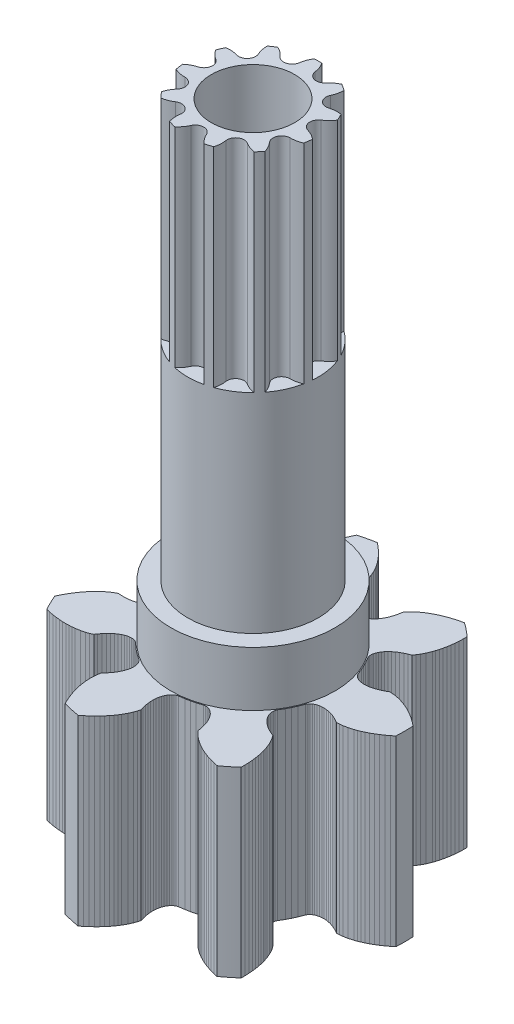
from build123d import *

# Parameters (mm, degrees)
SKETCH1_R           = 3.15
BOSS_EXTRUDE1_DEPTH = 2.1
SKETCH2_R           = 2.5
BOSS_EXTRUDE3_DEPTH = 16
BOSS_EXTRUDE4_DEPTH = 7
SKETCH3_R           = 1.1
SKETCH3_R_2         = 0.75
CUT_EXTRUDE2_DEPTH  = 20.858328167
SKETCH6_R           = 1.7
CUT_EXTRUDE3_DEPTH  = 7.6
SKETCH7_R           = 1.6
CUT_EXTRUDE4_DEPTH  = 20.313031807
SKETCH8_OUTSIDE_W   = 19.149
SKETCH8_OUTSIDE_H   = 19.428
CUT_EXTRUDE5_DEPTH  = 8


with BuildPart() as part:
    # Sketch1 → Boss-Extrude1 (new body)
    with BuildSketch(Plane(origin=(0, 0, 0), x_dir=(1, 0, 0), z_dir=(0, 1, 0))):
        with Locations(Location((0, 0, 0), (0, 0, 270))):
            Circle(SKETCH1_R)
    extrude(amount=BOSS_EXTRUDE1_DEPTH)

    # Sketch2 → Boss-Extrude3 (add)
    with BuildSketch(Plane(origin=(0, 2.1, 0), x_dir=(1, 0, 0), z_dir=(0, 1, 0))):
        with Locations(Location((0, 0, 0), (0, 0, 270))):
            Circle(SKETCH2_R)
    extrude(amount=BOSS_EXTRUDE3_DEPTH)

    # Sketch4 → Boss-Extrude4 (add)
    with BuildSketch(Plane.XZ):
        with BuildLine():
            Line((-1.677656104, -5.457545802), (-1.740166904, -5.314388502))
            Line((-1.740166904, -5.314388502), (-1.793915704, -5.175673402))
            Line((-1.793915704, -5.175673402), (-1.839244704, -5.042342702))
            Line((-1.839244704, -5.042342702), (-1.876421604, -4.915999102))
            Line((-1.876421604, -4.915999102), (-1.907053904, -4.793237402))
            Line((-1.907053904, -4.793237402), (-1.931099704, -4.676009702))
            Line((-1.931099704, -4.676009702), (-1.948773704, -4.566830802))
            Line((-1.948773704, -4.566830802), (-1.961024804, -4.464035702))
            Line((-1.961024804, -4.464035702), (-1.971502404, -4.279785302))
            Line((-1.971502404, -4.279785302), (-1.967365804, -4.124635702))
            Line((-1.967365804, -4.124635702), (-1.953730504, -4.000928102))
            Line((-1.953730504, -4.000928102), (-1.930260404, -3.886700602))
            Line((-1.930260404, -3.886700602), (-1.859391804, -3.809735002))
            Line((-1.859391804, -3.809735002), (-1.778417204, -3.712510502))
            Line((-1.778417204, -3.712510502), (-1.708697804, -3.615493902))
            Line((-1.708697804, -3.615493902), (-1.650076104, -3.519450202))
            Line((-1.650076104, -3.519450202), (-1.602332404, -3.425130202))
            Line((-1.602332404, -3.425130202), (-1.565200104, -3.333258302))
            Line((-1.565200104, -3.333258302), (-1.538382904, -3.244569502))
            Line((-1.538382904, -3.244569502), (-1.521548504, -3.159737902))
            Line((-1.521548504, -3.159737902), (-1.514299404, -3.079451802))
            Line((-1.514299404, -3.079451802), (-1.516222204, -3.004347502))
            Line((-1.516222204, -3.004347502), (-1.526863004, -2.935043002))
            Line((-1.526863004, -2.935043002), (-1.545721204, -2.872129302))
            Line((-1.545721204, -2.872129302), (-1.572279104, -2.816160102))
            Line((-1.572279104, -2.816160102), (-1.605971904, -2.767662302))
            Line((-1.605971904, -2.767662302), (-1.657232504, -2.718290402))
            Line((-1.657232504, -2.718290402), (-1.844744204, -2.592775302))
            Line((-1.844744204, -2.592775302), (-1.984007204, -2.487817902))
            Line((-1.984007204, -2.487817902), (-2.117322004, -2.375401802))
            Line((-2.117322004, -2.375401802), (-2.281415504, -2.220521102))
            Line((-2.281415504, -2.220521102), (-2.340956004, -2.181532002))
            Line((-2.340956004, -2.181532002), (-2.395735304, -2.159475702))
            Line((-2.395735304, -2.159475702), (-2.456210904, -2.146038102))
            Line((-2.456210904, -2.146038102), (-2.521743604, -2.141652302))
            Line((-2.521743604, -2.141652302), (-2.591678304, -2.146699902))
            Line((-2.591678304, -2.146699902), (-2.665327304, -2.161537602))
            Line((-2.665327304, -2.161537602), (-2.741987504, -2.186470302))
            Line((-2.741987504, -2.186470302), (-2.820946104, -2.221759402))
            Line((-2.820946104, -2.221759402), (-2.901443904, -2.267639402))
            Line((-2.901443904, -2.267639402), (-2.982749704, -2.324284202))
            Line((-2.982749704, -2.324284202), (-3.064080904, -2.391819002))
            Line((-3.064080904, -2.391819002), (-3.144672004, -2.470342602))
            Line((-3.144672004, -2.470342602), (-3.223742204, -2.559902302))
            Line((-3.223742204, -2.559902302), (-3.300510504, -2.660481102))
            Line((-3.300510504, -2.660481102), (-3.359776704, -2.746699402))
            Line((-3.359776704, -2.746699402), (-3.465917704, -2.794999002))
            Line((-3.465917704, -2.794999002), (-3.583489604, -2.835820002))
            Line((-3.583489604, -2.835820002), (-3.733828804, -2.874377002))
            Line((-3.733828804, -2.874377002), (-3.915791104, -2.905161502))
            Line((-3.915791104, -2.905161502), (-4.018735004, -2.916091602))
            Line((-4.018735004, -2.916091602), (-4.129109504, -2.923155402))
            Line((-4.129109504, -2.923155402), (-4.248748704, -2.925798102))
            Line((-4.248748704, -2.925798102), (-4.375248804, -2.923250802))
            Line((-4.375248804, -2.923250802), (-4.506697404, -2.915120202))
            Line((-4.506697404, -2.915120202), (-4.646771904, -2.900596502))
            Line((-4.646771904, -2.900596502), (-4.793969404, -2.879062302))
            Line((-4.793969404, -2.879062302), (-4.947447304, -2.849974302))
            Line((-4.947447304, -2.849974302), (-5.090225304, -2.816749202))
            ThreePointArc((-5.090225304, -2.816749202), (-5.241476502, -2.524161997), (-5.375926806, -2.223483907))
            Line((-5.375926806, -2.223483907), (-5.312882596, -2.091140098))
            Line((-5.312882596, -2.091140098), (-5.239932596, -1.953010098))
            Line((-5.239932596, -1.953010098), (-5.164992596, -1.824500098))
            Line((-5.164992596, -1.824500098), (-5.089012596, -1.705930098))
            Line((-5.089012596, -1.705930098), (-5.013412596, -1.598090098))
            Line((-5.013412596, -1.598090098), (-4.936532596, -1.497600098))
            Line((-4.936532596, -1.497600098), (-4.859872596, -1.405710098))
            Line((-4.859872596, -1.405710098), (-4.785532596, -1.323820098))
            Line((-4.785532596, -1.323820098), (-4.712802596, -1.250150098))
            Line((-4.712802596, -1.250150098), (-4.575282596, -1.127080098))
            Line((-4.575282596, -1.127080098), (-4.451402596, -1.033580098))
            Line((-4.451402596, -1.033580098), (-4.346182596, -0.967110098))
            Line((-4.346182596, -0.967110098), (-4.242242596, -0.914240098))
            Line((-4.242242596, -0.914240098), (-4.137882596, -0.921660098))
            Line((-4.137882596, -0.921660098), (-4.011382596, -0.924350098))
            Line((-4.011382596, -0.924350098), (-3.892062596, -0.918370098))
            Line((-3.892062596, -0.918370098), (-3.780422596, -0.904320098))
            Line((-3.780422596, -0.904320098), (-3.676912596, -0.882840098))
            Line((-3.676912596, -0.882840098), (-3.581932596, -0.854590098))
            Line((-3.581932596, -0.854590098), (-3.495872596, -0.820260098))
            Line((-3.495872596, -0.820260098), (-3.419052596, -0.780530098))
            Line((-3.419052596, -0.780530098), (-3.351762596, -0.736140098))
            Line((-3.351762596, -0.736140098), (-3.294242596, -0.687810098))
            Line((-3.294242596, -0.687810098), (-3.246692596, -0.636280098))
            Line((-3.246692596, -0.636280098), (-3.209262596, -0.582310098))
            Line((-3.209262596, -0.582310098), (-3.182062596, -0.526650098))
            Line((-3.182062596, -0.526650098), (-3.165152596, -0.470070098))
            Line((-3.165152596, -0.470070098), (-3.158512596, -0.399210098))
            Line((-3.158512596, -0.399210098), (-3.177292596, -0.174350098))
            Line((-3.177292596, -0.174350098), (-3.182062596, -3.0098e-05))
            Line((-3.182062596, -3.0098e-05), (-3.177292596, 0.174289902))
            Line((-3.177292596, 0.174289902), (-3.158512596, 0.399149902))
            Line((-3.158512596, 0.399149902), (-3.165152596, 0.470009902))
            Line((-3.165152596, 0.470009902), (-3.182062596, 0.526589902))
            Line((-3.182062596, 0.526589902), (-3.209262596, 0.582249902))
            Line((-3.209262596, 0.582249902), (-3.246692596, 0.636219902))
            Line((-3.246692596, 0.636219902), (-3.294242596, 0.687749902))
            Line((-3.294242596, 0.687749902), (-3.351762596, 0.736079902))
            Line((-3.351762596, 0.736079902), (-3.419052596, 0.780469902))
            Line((-3.419052596, 0.780469902), (-3.495872596, 0.820199902))
            Line((-3.495872596, 0.820199902), (-3.581932596, 0.854529902))
            Line((-3.581932596, 0.854529902), (-3.676912596, 0.882779902))
            Line((-3.676912596, 0.882779902), (-3.780422596, 0.904259902))
            Line((-3.780422596, 0.904259902), (-3.892062596, 0.918309902))
            Line((-3.892062596, 0.918309902), (-4.011382596, 0.924289902))
            Line((-4.011382596, 0.924289902), (-4.137882596, 0.921599902))
            Line((-4.137882596, 0.921599902), (-4.242242596, 0.914179902))
            Line((-4.242242596, 0.914179902), (-4.346182596, 0.967049902))
            Line((-4.346182596, 0.967049902), (-4.451402596, 1.033519902))
            Line((-4.451402596, 1.033519902), (-4.575282596, 1.127019902))
            Line((-4.575282596, 1.127019902), (-4.712802596, 1.250089902))
            Line((-4.712802596, 1.250089902), (-4.785532596, 1.323759902))
            Line((-4.785532596, 1.323759902), (-4.859872596, 1.405649902))
            Line((-4.859872596, 1.405649902), (-4.936532596, 1.497539902))
            Line((-4.936532596, 1.497539902), (-5.013412596, 1.598029902))
            Line((-5.013412596, 1.598029902), (-5.089012596, 1.705869902))
            Line((-5.089012596, 1.705869902), (-5.164992596, 1.824439902))
            Line((-5.164992596, 1.824439902), (-5.239932596, 1.952949902))
            Line((-5.239932596, 1.952949902), (-5.312882596, 2.091079902))
            Line((-5.312882596, 2.091079902), (-5.375926796, 2.223423702))
            ThreePointArc((-5.375926796, 2.223423702), (-5.241476491, 2.524101771), (-5.090225294, 2.816688957))
            Line((-5.090225294, 2.816688957), (-4.947447286, 2.849914054))
            Line((-4.947447286, 2.849914054), (-4.793969386, 2.879002054))
            Line((-4.793969386, 2.879002054), (-4.646771886, 2.900536254))
            Line((-4.646771886, 2.900536254), (-4.506697386, 2.915059954))
            Line((-4.506697386, 2.915059954), (-4.375248786, 2.923190554))
            Line((-4.375248786, 2.923190554), (-4.248748686, 2.925737854))
            Line((-4.248748686, 2.925737854), (-4.129109486, 2.923095154))
            Line((-4.129109486, 2.923095154), (-4.018734986, 2.916031354))
            Line((-4.018734986, 2.916031354), (-3.915791086, 2.905101254))
            Line((-3.915791086, 2.905101254), (-3.733828786, 2.874316754))
            Line((-3.733828786, 2.874316754), (-3.583489586, 2.835759754))
            Line((-3.583489586, 2.835759754), (-3.465917686, 2.794938754))
            Line((-3.465917686, 2.794938754), (-3.359776686, 2.746639154))
            Line((-3.359776686, 2.746639154), (-3.300510486, 2.660420854))
            Line((-3.300510486, 2.660420854), (-3.223742186, 2.559842054))
            Line((-3.223742186, 2.559842054), (-3.144671986, 2.470282354))
            Line((-3.144671986, 2.470282354), (-3.064080886, 2.391758754))
            Line((-3.064080886, 2.391758754), (-2.982749686, 2.324223954))
            Line((-2.982749686, 2.324223954), (-2.901443886, 2.267579154))
            Line((-2.901443886, 2.267579154), (-2.820946086, 2.221699154))
            Line((-2.820946086, 2.221699154), (-2.741987486, 2.186410054))
            Line((-2.741987486, 2.186410054), (-2.665327286, 2.161477354))
            Line((-2.665327286, 2.161477354), (-2.591678286, 2.146639654))
            Line((-2.591678286, 2.146639654), (-2.521743586, 2.141592054))
            Line((-2.521743586, 2.141592054), (-2.456210886, 2.145977854))
            Line((-2.456210886, 2.145977854), (-2.395735286, 2.159415454))
            Line((-2.395735286, 2.159415454), (-2.340955986, 2.181471754))
            Line((-2.340955986, 2.181471754), (-2.281415486, 2.220460854))
            Line((-2.281415486, 2.220460854), (-2.117321986, 2.375341554))
            Line((-2.117321986, 2.375341554), (-1.984007186, 2.487757654))
            Line((-1.984007186, 2.487757654), (-1.844744186, 2.592715054))
            Line((-1.844744186, 2.592715054), (-1.657232486, 2.718230154))
            Line((-1.657232486, 2.718230154), (-1.605971886, 2.767602054))
            Line((-1.605971886, 2.767602054), (-1.572279086, 2.816099854))
            Line((-1.572279086, 2.816099854), (-1.545721186, 2.872069054))
            Line((-1.545721186, 2.872069054), (-1.526862986, 2.934982754))
            Line((-1.526862986, 2.934982754), (-1.516222186, 3.004287254))
            Line((-1.516222186, 3.004287254), (-1.514299386, 3.079391554))
            Line((-1.514299386, 3.079391554), (-1.521548486, 3.159677654))
            Line((-1.521548486, 3.159677654), (-1.538382886, 3.244509254))
            Line((-1.538382886, 3.244509254), (-1.565200086, 3.333198054))
            Line((-1.565200086, 3.333198054), (-1.602332386, 3.425069954))
            Line((-1.602332386, 3.425069954), (-1.650076086, 3.519389954))
            Line((-1.650076086, 3.519389954), (-1.708697786, 3.615433654))
            Line((-1.708697786, 3.615433654), (-1.778417186, 3.712450254))
            Line((-1.778417186, 3.712450254), (-1.859391786, 3.809674754))
            Line((-1.859391786, 3.809674754), (-1.930260386, 3.886640354))
            Line((-1.930260386, 3.886640354), (-1.953730486, 4.000867854))
            Line((-1.953730486, 4.000867854), (-1.967365786, 4.124575454))
            Line((-1.967365786, 4.124575454), (-1.971502386, 4.279725054))
            Line((-1.971502386, 4.279725054), (-1.961024786, 4.463975454))
            Line((-1.961024786, 4.463975454), (-1.948773686, 4.566770554))
            Line((-1.948773686, 4.566770554), (-1.931099686, 4.675949454))
            Line((-1.931099686, 4.675949454), (-1.907053886, 4.793177154))
            Line((-1.907053886, 4.793177154), (-1.876421586, 4.915938854))
            Line((-1.876421586, 4.915938854), (-1.839244686, 5.042282454))
            Line((-1.839244686, 5.042282454), (-1.793915686, 5.175613154))
            Line((-1.793915686, 5.175613154), (-1.740166886, 5.314328254))
            Line((-1.740166886, 5.314328254), (-1.677656086, 5.457485554))
            Line((-1.677656086, 5.457485554), (-1.613492886, 5.589290554))
            ThreePointArc((-1.613492886, 5.589290554), (-1.294584924, 5.671642777), (-0.971527485, 5.735814951))
            Line((-0.971527485, 5.735814951), (-0.856530379, 5.644902123))
            Line((-0.856530379, 5.644902123), (-0.738096579, 5.543044323))
            Line((-0.738096579, 5.543044323), (-0.629484279, 5.441387023))
            Line((-0.629484279, 5.441387023), (-0.530794179, 5.340927723))
            Line((-0.530794179, 5.340927723), (-0.442480579, 5.243226523))
            Line((-0.442480579, 5.243226523), (-0.361617479, 5.145912923))
            Line((-0.361617479, 5.145912923), (-0.289089779, 5.050727423))
            Line((-0.289089779, 5.050727423), (-0.225795179, 4.960029123))
            Line((-0.225795179, 4.960029123), (-0.170156179, 4.872729423))
            Line((-0.170156179, 4.872729423), (-0.080772879, 4.711271723))
            Line((-0.080772879, 4.711271723), (-0.017182979, 4.569691923))
            Line((-0.017182979, 4.569691923), (0.024206821, 4.452319023))
            Line((0.024206821, 4.452319023), (0.052622421, 4.339220423))
            Line((0.052622421, 4.339220423), (0.022166221, 4.239128023))
            Line((0.022166221, 4.239128023), (-0.008605279, 4.116398223))
            Line((-0.008605279, 4.116398223), (-0.029326379, 3.998739123))
            Line((-0.029326379, 3.998739123), (-0.040470879, 3.886771723))
            Line((-0.040470879, 3.886771723), (-0.042562579, 3.781077223))
            Line((-0.042562579, 3.781077223), (-0.036155879, 3.682192323))
            Line((-0.036155879, 3.682192323), (-0.021836779, 3.590650923))
            Line((-0.021836779, 3.590650923), (-0.000196979, 3.506916223))
            Line((-0.000196979, 3.506916223), (0.028106621, 3.431435623))
            Line((0.028106621, 3.431435623), (0.062425521, 3.364603323))
            Line((0.062425521, 3.364603323), (0.102082621, 3.306779023))
            Line((0.102082621, 3.306779023), (0.146370621, 3.258277923))
            Line((0.146370621, 3.258277923), (0.194582521, 3.219374423))
            Line((0.194582521, 3.219374423), (0.245981121, 3.190298123))
            Line((0.245981121, 3.190298123), (0.313586921, 3.168056823))
            Line((0.313586921, 3.168056823), (0.536988121, 3.136329923))
            Line((0.536988121, 3.136329923), (0.707999021, 3.102190423))
            Line((0.707999021, 3.102190423), (0.876887021, 3.058750223))
            Line((0.876887021, 3.058750223), (1.091930421, 2.990405023))
            Line((1.091930421, 2.990405023), (1.162491321, 2.981110623))
            Line((1.162491321, 2.981110623), (1.221415521, 2.985006423))
            Line((1.221415521, 2.985006423), (1.281732621, 2.999139023))
            Line((1.281732621, 2.999139023), (1.342678421, 3.023621123))
            Line((1.342678421, 3.023621123), (1.403497321, 3.058512423))
            Line((1.403497321, 3.058512423), (1.463415021, 3.103835823))
            Line((1.463415021, 3.103835823), (1.521665521, 3.159561023))
            Line((1.521665521, 3.159561023), (1.577493421, 3.225614223))
            Line((1.577493421, 3.225614223), (1.630112821, 3.301877423))
            Line((1.630112821, 3.301877423), (1.678789621, 3.388189823))
            Line((1.678789621, 3.388189823), (1.722764221, 3.484324823))
            Line((1.722764221, 3.484324823), (1.761304221, 3.590039423))
            Line((1.761304221, 3.590039423), (1.793685421, 3.705037123))
            Line((1.793685421, 3.705037123), (1.819211821, 3.828964023))
            Line((1.819211821, 3.828964023), (1.835200121, 3.932358623))
            Line((1.835200121, 3.932358623), (1.909873421, 4.021928023))
            Line((1.909873421, 4.021928023), (1.998090521, 4.109718923))
            Line((1.998090521, 4.109718923), (2.116812121, 4.209687323))
            Line((2.116812121, 4.209687323), (2.267397621, 4.316373723))
            Line((2.267397621, 4.316373723), (2.355404521, 4.370887123))
            Line((2.355404521, 4.370887123), (2.451783521, 4.425141023))
            Line((2.451783521, 4.425141023), (2.558428121, 4.479431523))
            Line((2.558428121, 4.479431523), (2.673506021, 4.532022823))
            Line((2.673506021, 4.532022823), (2.795464821, 4.581730723))
            Line((2.795464821, 4.581730723), (2.927969221, 4.629421523))
            Line((2.927969221, 4.629421523), (3.069932921, 4.673886423))
            Line((3.069932921, 4.673886423), (3.220832621, 4.714270623))
            Line((3.220832621, 4.714270623), (3.363886921, 4.746284823))
            ThreePointArc((3.363886921, 4.746284823), (3.627108363, 4.548298309), (3.878703226, 4.335732528))
            Line((3.878703226, 4.335732528), (3.879324236, 4.189141042))
            Line((3.879324236, 4.189141042), (3.873530936, 4.033038442))
            Line((3.873530936, 4.033038442), (3.861770736, 3.884739642))
            Line((3.861770736, 3.884739642), (3.844760636, 3.744945242))
            Line((3.844760636, 3.744945242), (3.823437436, 3.614983242))
            Line((3.823437436, 3.614983242), (3.797771936, 3.491087842))
            Line((3.797771936, 3.491087842), (3.768573236, 3.375036342))
            Line((3.768573236, 3.375036342), (3.737125936, 3.269001042))
            Line((3.737125936, 3.269001042), (3.703562736, 3.171070342))
            Line((3.703562736, 3.171070342), (3.633059536, 3.000520342))
            Line((3.633059536, 3.000520342), (3.562015636, 2.862530242))
            Line((3.562015636, 2.862530242), (3.496055936, 2.756989642))
            Line((3.496055936, 2.756989642), (3.425348736, 2.664257542))
            Line((3.425348736, 2.664257542), (3.328104136, 2.625662642))
            Line((3.328104136, 2.625662642), (3.212964436, 2.573199942))
            Line((3.212964436, 2.573199942), (3.108055436, 2.516041142))
            Line((3.108055436, 2.516041142), (3.013567336, 2.454943742))
            Line((3.013567336, 2.454943742), (2.929627936, 2.390679642))
            Line((2.929627936, 2.390679642), (2.856311136, 2.324016942))
            Line((2.856311136, 2.324016942), (2.793668936, 2.255746642))
            Line((2.793668936, 2.255746642), (2.741694736, 2.186620242))
            Line((2.741694736, 2.186620242), (2.700328636, 2.117430142))
            Line((2.700328636, 2.117430142), (2.669474536, 2.048929342))
            Line((2.669474536, 2.048929342), (2.648991436, 1.981871242))
            Line((2.648991436, 1.981871242), (2.638684936, 1.917005642))
            Line((2.638684936, 1.917005642), (2.638328536, 1.855056142))
            Line((2.638328536, 1.855056142), (2.647642236, 1.796742342))
            Line((2.647642236, 1.796742342), (2.672404836, 1.730018642))
            Line((2.672404836, 1.730018642), (2.786888136, 1.535575142))
            Line((2.786888136, 1.535575142), (2.866820336, 1.380587942))
            Line((2.866820336, 1.380587942), (2.938157336, 1.221461342))
            Line((2.938157336, 1.221461342), (3.018800236, 1.010721142))
            Line((3.018800236, 1.010721142), (3.055527736, 0.949759542))
            Line((3.055527736, 0.949759542), (3.095312236, 0.906119642))
            Line((3.095312236, 0.906119642), (3.143968536, 0.867773342))
            Line((3.143968536, 0.867773342), (3.201108536, 0.835388342))
            Line((3.201108536, 0.835388342), (3.266307636, 0.809592642))
            Line((3.266307636, 0.809592642), (3.339100936, 0.791005742))
            Line((3.339100936, 0.791005742), (3.418987236, 0.780207842))
            Line((3.418987236, 0.780207842), (3.505437836, 0.777743242))
            Line((3.505437836, 0.777743242), (3.597870436, 0.784153042))
            Line((3.597870436, 0.784153042), (3.695701736, 0.799910942))
            Line((3.695701736, 0.799910942), (3.798280836, 0.825469442))
            Line((3.798280836, 0.825469442), (3.904961036, 0.861249642))
            Line((3.904961036, 0.861249642), (4.015059336, 0.907632842))
            Line((4.015059336, 0.907632842), (4.127864736, 0.964942742))
            Line((4.127864736, 0.964942742), (4.218670436, 1.016908042))
            Line((4.218670436, 1.016908042), (4.335256536, 1.014371642))
            Line((4.335256536, 1.014371642), (4.458896736, 1.000137542))
            Line((4.458896736, 1.000137542), (4.611076836, 0.969646442))
            Line((4.611076836, 0.969646442), (4.788376236, 0.918431942))
            Line((4.788376236, 0.918431942), (4.885867836, 0.883613842))
            Line((4.885867836, 0.883613842), (4.988376636, 0.842088442))
            Line((4.988376636, 0.842088442), (5.097314536, 0.792559942))
            Line((5.097314536, 0.792559942), (5.210181936, 0.735378542))
            Line((5.210181936, 0.735378542), (5.325085236, 0.671019742))
            Line((5.325085236, 0.671019742), (5.444986436, 0.597158342))
            Line((5.444986436, 0.597158342), (5.568263436, 0.513890042))
            Line((5.568263436, 0.513890042), (5.693921436, 0.421091042))
            Line((5.693921436, 0.421091042), (5.808144136, 0.329207242))
            ThreePointArc((5.808144136, 0.329207242), (5.817467929, -3.016e-05), (5.808144136, -0.329267562))
            Line((5.808144136, -0.329267562), (5.693921429, -0.421151358))
            Line((5.693921429, -0.421151358), (5.568263429, -0.513950358))
            Line((5.568263429, -0.513950358), (5.444986429, -0.597218658))
            Line((5.444986429, -0.597218658), (5.325085229, -0.671080058))
            Line((5.325085229, -0.671080058), (5.210181929, -0.735438858))
            Line((5.210181929, -0.735438858), (5.097314529, -0.792620258))
            Line((5.097314529, -0.792620258), (4.988376629, -0.842148758))
            Line((4.988376629, -0.842148758), (4.885867829, -0.883674158))
            Line((4.885867829, -0.883674158), (4.788376229, -0.918492258))
            Line((4.788376229, -0.918492258), (4.611076829, -0.969706758))
            Line((4.611076829, -0.969706758), (4.458896729, -1.000197858))
            Line((4.458896729, -1.000197858), (4.335256529, -1.014431958))
            Line((4.335256529, -1.014431958), (4.218670429, -1.016968358))
            Line((4.218670429, -1.016968358), (4.127864729, -0.965003058))
            Line((4.127864729, -0.965003058), (4.015059329, -0.907693158))
            Line((4.015059329, -0.907693158), (3.904961029, -0.861309958))
            Line((3.904961029, -0.861309958), (3.798280829, -0.825529758))
            Line((3.798280829, -0.825529758), (3.695701729, -0.799971258))
            Line((3.695701729, -0.799971258), (3.597870429, -0.784213358))
            Line((3.597870429, -0.784213358), (3.505437829, -0.777803558))
            Line((3.505437829, -0.777803558), (3.418987229, -0.780268158))
            Line((3.418987229, -0.780268158), (3.339100929, -0.791066058))
            Line((3.339100929, -0.791066058), (3.266307629, -0.809652958))
            Line((3.266307629, -0.809652958), (3.201108529, -0.835448658))
            Line((3.201108529, -0.835448658), (3.143968529, -0.867833658))
            Line((3.143968529, -0.867833658), (3.095312229, -0.906179958))
            Line((3.095312229, -0.906179958), (3.055527729, -0.949819858))
            Line((3.055527729, -0.949819858), (3.018800229, -1.010781458))
            Line((3.018800229, -1.010781458), (2.938157329, -1.221521658))
            Line((2.938157329, -1.221521658), (2.866820329, -1.380648258))
            Line((2.866820329, -1.380648258), (2.786888129, -1.535635458))
            Line((2.786888129, -1.535635458), (2.672404829, -1.730078958))
            Line((2.672404829, -1.730078958), (2.647642229, -1.796802658))
            Line((2.647642229, -1.796802658), (2.638328529, -1.855116458))
            Line((2.638328529, -1.855116458), (2.638684929, -1.917065958))
            Line((2.638684929, -1.917065958), (2.648991429, -1.981931558))
            Line((2.648991429, -1.981931558), (2.669474529, -2.048989658))
            Line((2.669474529, -2.048989658), (2.700328629, -2.117490458))
            Line((2.700328629, -2.117490458), (2.741694729, -2.186680558))
            Line((2.741694729, -2.186680558), (2.793668929, -2.255806958))
            Line((2.793668929, -2.255806958), (2.856311129, -2.324077258))
            Line((2.856311129, -2.324077258), (2.929627929, -2.390739958))
            Line((2.929627929, -2.390739958), (3.013567329, -2.455004058))
            Line((3.013567329, -2.455004058), (3.108055429, -2.516101458))
            Line((3.108055429, -2.516101458), (3.212964429, -2.573260258))
            Line((3.212964429, -2.573260258), (3.328104129, -2.625722958))
            Line((3.328104129, -2.625722958), (3.425348729, -2.664317858))
            Line((3.425348729, -2.664317858), (3.496055929, -2.757049958))
            Line((3.496055929, -2.757049958), (3.562015629, -2.862590558))
            Line((3.562015629, -2.862590558), (3.633059529, -3.000580658))
            Line((3.633059529, -3.000580658), (3.703562729, -3.171130658))
            Line((3.703562729, -3.171130658), (3.737125929, -3.269061358))
            Line((3.737125929, -3.269061358), (3.768573229, -3.375096658))
            Line((3.768573229, -3.375096658), (3.797771929, -3.491148158))
            Line((3.797771929, -3.491148158), (3.823437429, -3.615043558))
            Line((3.823437429, -3.615043558), (3.844760629, -3.745005558))
            Line((3.844760629, -3.745005558), (3.861770729, -3.884799958))
            Line((3.861770729, -3.884799958), (3.873530929, -4.033098758))
            Line((3.873530929, -4.033098758), (3.879324229, -4.189201358))
            Line((3.879324229, -4.189201358), (3.878703229, -4.335792858))
            ThreePointArc((3.878703229, -4.335792858), (3.627108367, -4.548358644), (3.363886927, -4.746345161))
            Line((3.363886927, -4.746345161), (3.220832594, -4.714330914))
            Line((3.220832594, -4.714330914), (3.069932894, -4.673946714))
            Line((3.069932894, -4.673946714), (2.927969194, -4.629481814))
            Line((2.927969194, -4.629481814), (2.795464794, -4.581791014))
            Line((2.795464794, -4.581791014), (2.673505994, -4.532083114))
            Line((2.673505994, -4.532083114), (2.558428094, -4.479491814))
            Line((2.558428094, -4.479491814), (2.451783494, -4.425201314))
            Line((2.451783494, -4.425201314), (2.355404494, -4.370947414))
            Line((2.355404494, -4.370947414), (2.267397594, -4.316434014))
            Line((2.267397594, -4.316434014), (2.116812094, -4.209747614))
            Line((2.116812094, -4.209747614), (1.998090494, -4.109779214))
            Line((1.998090494, -4.109779214), (1.909873394, -4.021988314))
            Line((1.909873394, -4.021988314), (1.835200094, -3.932418914))
            Line((1.835200094, -3.932418914), (1.819211794, -3.829024314))
            Line((1.819211794, -3.829024314), (1.793685394, -3.705097414))
            Line((1.793685394, -3.705097414), (1.761304194, -3.590099714))
            Line((1.761304194, -3.590099714), (1.722764194, -3.484385114))
            Line((1.722764194, -3.484385114), (1.678789594, -3.388250114))
            Line((1.678789594, -3.388250114), (1.630112794, -3.301937714))
            Line((1.630112794, -3.301937714), (1.577493394, -3.225674514))
            Line((1.577493394, -3.225674514), (1.521665494, -3.159621314))
            Line((1.521665494, -3.159621314), (1.463414994, -3.103896114))
            Line((1.463414994, -3.103896114), (1.403497294, -3.058572714))
            Line((1.403497294, -3.058572714), (1.342678394, -3.023681414))
            Line((1.342678394, -3.023681414), (1.281732594, -2.999199314))
            Line((1.281732594, -2.999199314), (1.221415494, -2.985066714))
            Line((1.221415494, -2.985066714), (1.162491294, -2.981170914))
            Line((1.162491294, -2.981170914), (1.091930394, -2.990465314))
            Line((1.091930394, -2.990465314), (0.876886994, -3.058810514))
            Line((0.876886994, -3.058810514), (0.707998994, -3.102250714))
            Line((0.707998994, -3.102250714), (0.536988094, -3.136390214))
            Line((0.536988094, -3.136390214), (0.313586894, -3.168117114))
            Line((0.313586894, -3.168117114), (0.245981094, -3.190358414))
            Line((0.245981094, -3.190358414), (0.194582494, -3.219434714))
            Line((0.194582494, -3.219434714), (0.146370594, -3.258338214))
            Line((0.146370594, -3.258338214), (0.102082594, -3.306839314))
            Line((0.102082594, -3.306839314), (0.062425494, -3.364663614))
            Line((0.062425494, -3.364663614), (0.028106594, -3.431495914))
            Line((0.028106594, -3.431495914), (-0.000197006, -3.506976514))
            Line((-0.000197006, -3.506976514), (-0.021836806, -3.590711214))
            Line((-0.021836806, -3.590711214), (-0.036155906, -3.682252614))
            Line((-0.036155906, -3.682252614), (-0.042562606, -3.781137514))
            Line((-0.042562606, -3.781137514), (-0.040470906, -3.886832014))
            Line((-0.040470906, -3.886832014), (-0.029326406, -3.998799414))
            Line((-0.029326406, -3.998799414), (-0.008605306, -4.116458514))
            Line((-0.008605306, -4.116458514), (0.022166194, -4.239188314))
            Line((0.022166194, -4.239188314), (0.052622394, -4.339280714))
            Line((0.052622394, -4.339280714), (0.024206794, -4.452379314))
            Line((0.024206794, -4.452379314), (-0.017183006, -4.569752214))
            Line((-0.017183006, -4.569752214), (-0.080772906, -4.711332014))
            Line((-0.080772906, -4.711332014), (-0.170156206, -4.872789714))
            Line((-0.170156206, -4.872789714), (-0.225795206, -4.960089414))
            Line((-0.225795206, -4.960089414), (-0.289089806, -5.050787714))
            Line((-0.289089806, -5.050787714), (-0.361617506, -5.145973214))
            Line((-0.361617506, -5.145973214), (-0.442480606, -5.243286814))
            Line((-0.442480606, -5.243286814), (-0.530794206, -5.340988014))
            Line((-0.530794206, -5.340988014), (-0.629484306, -5.441447314))
            Line((-0.629484306, -5.441447314), (-0.738096606, -5.543104614))
            Line((-0.738096606, -5.543104614), (-0.856530406, -5.644962414))
            Line((-0.856530406, -5.644962414), (-0.971527506, -5.735875214))
            ThreePointArc((-0.971527506, -5.735875214), (-1.294584942, -5.671703035), (-1.613492901, -5.589350807))
            Line((-1.613492901, -5.589350807), (-1.677656104, -5.457545802))
        make_face()
    extrude(amount=BOSS_EXTRUDE4_DEPTH)

    # Sketch3 → Cut-Extrude2 (cut, through all)
    # profile 1 of 2: a face of its own
    with BuildSketch(Plane.XZ):
        with Locations(Location((0, 0, 0), (0, 0, 90))):
            Circle(SKETCH3_R)
        Circle(SKETCH3_R_2, mode=Mode.SUBTRACT)
    # profile 2 of 2: a face of its own
    with BuildSketch(Plane.XZ):
        Circle(SKETCH3_R_2)
    extrude(amount=CUT_EXTRUDE2_DEPTH, mode=Mode.SUBTRACT)

    # Sketch6 → Cut-Extrude3 (cut)
    with BuildSketch(Plane.XZ.offset(7)):
        with Locations(Location((0, 0, 0), (0, 0, 270))):
            Circle(SKETCH6_R)
    extrude(amount=-CUT_EXTRUDE3_DEPTH, mode=Mode.SUBTRACT)

    # Sketch7 → Cut-Extrude4 (cut, through all)
    with BuildSketch(Plane.XZ.offset(-0.6)):
        with Locations(Location((0, 0, 0), (0, 0, 270))):
            Circle(SKETCH7_R)
    extrude(amount=-CUT_EXTRUDE4_DEPTH, mode=Mode.SUBTRACT)

    # Sketch8 outside → Cut-Extrude5 (cut)
    with BuildSketch(Plane(origin=(0, 18.1, 0), x_dir=(1, 0, 0), z_dir=(0, 1, 0))):
        with Locations((0.2205, 0)):
            Rectangle(SKETCH8_OUTSIDE_W, SKETCH8_OUTSIDE_H)
        with BuildLine():
            ThreePointArc((-0.874874584, -1.914509945), (-0.872847435, -1.898524314), (-0.871608771, -1.882458342))
            ThreePointArc((-0.871608771, -1.882458342), (-1.021648634, -1.589716304), (-1.350264969, -1.574844682))
            ThreePointArc((-1.350264969, -1.574844682), (-1.364364531, -1.582645457), (-1.378063464, -1.591130087))
            ThreePointArc((-1.378063464, -1.591130087), (-1.575187068, -1.691186219), (-1.789333192, -1.746053167))
            ThreePointArc((-1.789333192, -1.746053167), (-1.889436652, -1.637206179), (-1.982929527, -1.522631086))
            ThreePointArc((-1.982929527, -1.522631086), (-1.898144875, -1.318473041), (-1.771053556, -1.137595344))
            ThreePointArc((-1.771053556, -1.137595344), (-1.760705725, -1.125243335), (-1.750977775, -1.112397452))
            ThreePointArc((-1.750977775, -1.112397452), (-1.718931045, -0.785009505), (-1.987340492, -0.594835296))
            ThreePointArc((-1.987340492, -0.594835296), (-2.003419215, -0.593774926), (-2.019530629, -0.593506449))
            ThreePointArc((-2.019530629, -0.593506449), (-2.239455986, -0.571105958), (-2.449270481, -0.501486836))
            ThreePointArc((-2.449270481, -0.501486836), (-2.474635746, -0.355798906), (-2.491342985, -0.20886614))
            ThreePointArc((-2.491342985, -0.20886614), (-2.309641425, -0.082955507), (-2.104935538, 0.00049774))
            ThreePointArc((-2.104935538, 0.00049774), (-2.089552388, 0.005294452), (-2.074423707, 0.010841769))
            ThreePointArc((-2.074423707, 0.010841769), (-1.870464994, 0.268932266), (-1.99344945, 0.574030094))
            ThreePointArc((-1.99344945, 0.574030094), (-2.006402454, 0.583614948), (-2.019811088, 0.592551293))
            ThreePointArc((-2.019811088, 0.592551293), (-2.192713451, 0.73029641), (-2.331581698, 0.902298023))
            ThreePointArc((-2.331581698, 0.902298023), (-2.274155475, 1.038572006), (-2.208772648, 1.17121233))
            ThreePointArc((-2.208772648, 1.17121233), (-1.987843141, 1.178899814), (-1.770515359, 1.138432796))
            ThreePointArc((-1.770515359, 1.138432796), (-1.754980932, 1.134151287), (-1.739254769, 1.130638805))
            ThreePointArc((-1.739254769, 1.130638805), (-1.428139525, 1.237489942), (-1.366652294, 1.560644985))
            ThreePointArc((-1.366652294, 1.560644985), (-1.37236709, 1.5757112), (-1.378815798, 1.590478186))
            ThreePointArc((-1.378815798, 1.590478186), (-1.449799889, 1.799834828), (-1.4736322, 2.019609634))
            ThreePointArc((-1.4736322, 2.019609634), (-1.351646909, 2.103203644), (-1.224932602, 2.179439161))
            ThreePointArc((-1.224932602, 2.179439161), (-1.034918706, 2.066462775), (-0.873969064, 1.914923482))
            ThreePointArc((-0.873969064, 1.914923482), (-0.86321543, 1.902923103), (-0.851884731, 1.891466009))
            ThreePointArc((-0.851884731, 1.891466009), (-0.532389846, 1.813153306), (-0.30595269, 2.05176612))
            ThreePointArc((-0.30595269, 2.05176612), (-0.302614872, 2.067530279), (-0.300056235, 2.083439494))
            ThreePointArc((-0.300056235, 2.083439494), (-0.246585106, 2.297938405), (-0.14781489, 2.495709457))
            ThreePointArc((-0.14781489, 2.495709457), (-0.073939789, 2.498989364), (0, 2.500082986))
            ThreePointArc((0, 2.500082986), (0.073939789, 2.498989364), (0.14781489, 2.495709457))
            ThreePointArc((0.14781489, 2.495709457), (0.246585106, 2.297938405), (0.300056235, 2.083439494))
            ThreePointArc((0.300056235, 2.083439494), (0.302614872, 2.067530279), (0.30595269, 2.05176612))
            ThreePointArc((0.30595269, 2.05176612), (0.532389846, 1.813153306), (0.851884731, 1.891466009))
            ThreePointArc((0.851884731, 1.891466009), (0.86321543, 1.902923103), (0.873969064, 1.914923482))
            ThreePointArc((0.873969064, 1.914923482), (1.034918706, 2.066462775), (1.224932602, 2.179439161))
            ThreePointArc((1.224932602, 2.179439161), (1.351646909, 2.103203644), (1.4736322, 2.019609634))
            ThreePointArc((1.4736322, 2.019609634), (1.449799889, 1.799834828), (1.378815798, 1.590478186))
            ThreePointArc((1.378815798, 1.590478186), (1.37236709, 1.5757112), (1.366652294, 1.560644985))
            ThreePointArc((1.366652294, 1.560644985), (1.428139525, 1.237489942), (1.739254769, 1.130638805))
            ThreePointArc((1.739254769, 1.130638805), (1.754980932, 1.134151287), (1.770515359, 1.138432796))
            ThreePointArc((1.770515359, 1.138432796), (1.987843141, 1.178899814), (2.208772648, 1.17121233))
            ThreePointArc((2.208772648, 1.17121233), (2.274155475, 1.038572006), (2.331581698, 0.902298023))
            ThreePointArc((2.331581698, 0.902298023), (2.192713451, 0.73029641), (2.019811088, 0.592551293))
            ThreePointArc((2.019811088, 0.592551293), (2.006402454, 0.583614948), (1.99344945, 0.574030094))
            ThreePointArc((1.99344945, 0.574030094), (1.870464994, 0.268932266), (2.074423707, 0.010841769))
            ThreePointArc((2.074423707, 0.010841769), (2.089552388, 0.005294452), (2.104935538, 0.00049774))
            ThreePointArc((2.104935538, 0.00049774), (2.309641425, -0.082955507), (2.491342985, -0.20886614))
            ThreePointArc((2.491342985, -0.20886614), (2.474635746, -0.355798906), (2.449270481, -0.501486836))
            ThreePointArc((2.449270481, -0.501486836), (2.239455986, -0.571105958), (2.019530629, -0.593506449))
            ThreePointArc((2.019530629, -0.593506449), (2.003419215, -0.593774926), (1.987340492, -0.594835296))
            ThreePointArc((1.987340492, -0.594835296), (1.718931045, -0.785009505), (1.750977775, -1.112397452))
            ThreePointArc((1.750977775, -1.112397452), (1.760705725, -1.125243335), (1.771053556, -1.137595344))
            ThreePointArc((1.771053556, -1.137595344), (1.898144875, -1.318473041), (1.982929527, -1.522631086))
            ThreePointArc((1.982929527, -1.522631086), (1.889436652, -1.637206179), (1.789333192, -1.746053167))
            ThreePointArc((1.789333192, -1.746053167), (1.575187069, -1.691186219), (1.378063467, -1.591130087))
            ThreePointArc((1.378063467, -1.591130087), (1.364364533, -1.582645456), (1.350264971, -1.574844682))
            ThreePointArc((1.350264971, -1.574844682), (1.021648634, -1.589716304), (0.871608771, -1.882458343))
            ThreePointArc((0.871608771, -1.882458343), (0.872847435, -1.898524314), (0.874874584, -1.914509946))
            ThreePointArc((0.874874584, -1.914509946), (0.884000739, -2.135384701), (0.844949955, -2.352971421))
            ThreePointArc((0.844949955, -2.352971421), (0.704354772, -2.398812058), (0.561295258, -2.436259955))
            ThreePointArc((0.561295258, -2.436259955), (0.410807386, -2.274326806), (0.299070887, -2.083581165))
            ThreePointArc((0.299070887, -2.083581165), (0.292133749, -2.069037237), (0.284489859, -2.05485201))
            ThreePointArc((0.284489859, -2.05485201), (0, -1.88969941), (-0.284489859, -2.054852009))
            ThreePointArc((-0.284489859, -2.054852009), (-0.292133749, -2.069037237), (-0.299070887, -2.083581165))
            ThreePointArc((-0.299070887, -2.083581165), (-0.410807386, -2.274326806), (-0.561295258, -2.436259955))
            ThreePointArc((-0.561295258, -2.436259955), (-0.704354772, -2.398812058), (-0.844949955, -2.352971421))
            ThreePointArc((-0.844949955, -2.352971421), (-0.884000739, -2.135384701), (-0.874874584, -1.914509945))
        make_face(mode=Mode.SUBTRACT)
    extrude(amount=-CUT_EXTRUDE5_DEPTH, mode=Mode.SUBTRACT)


solid = part.part
